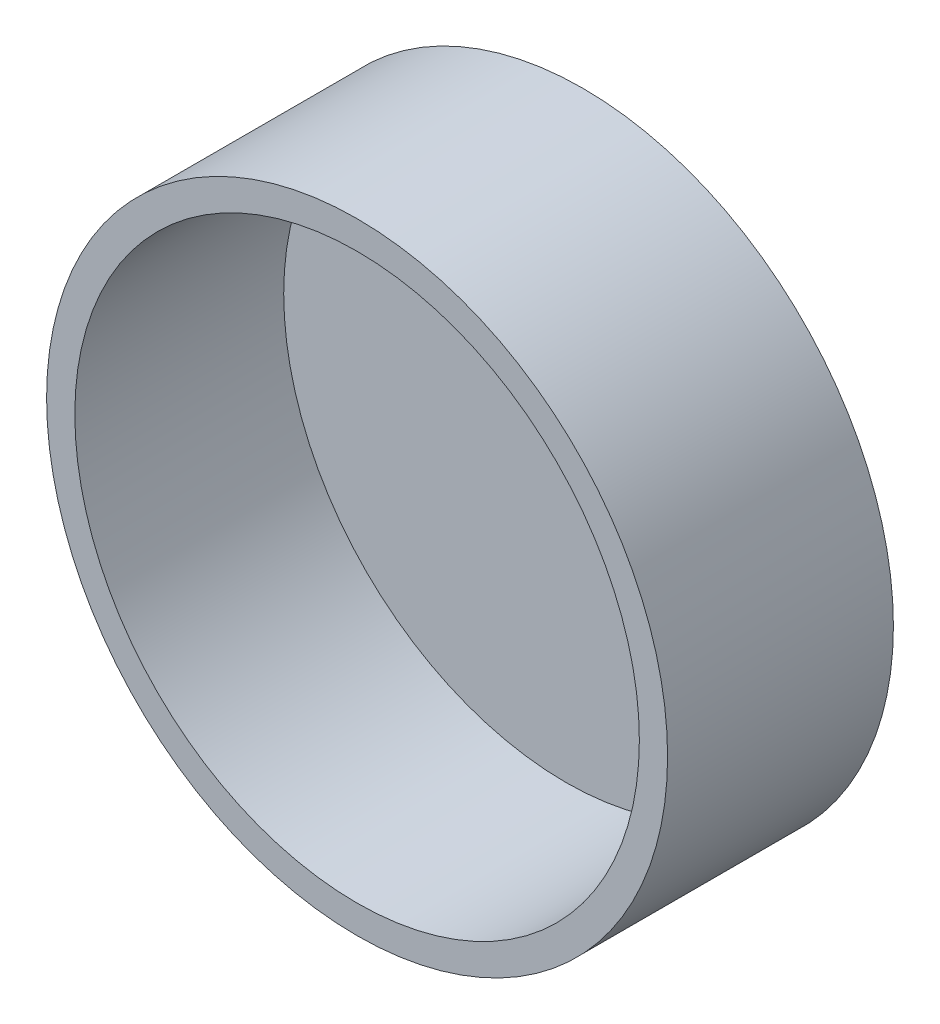
from build123d import *

# Parameters (mm, degrees)
SKETCH1_R           = 100
SKETCH1_R_2         = 14
SKETCH1_R_3         = 2.25
BOSS_EXTRUDE1_DEPTH = 6
SKETCH1_3_R         = 110
SKETCH1_3_R_2       = 100
BOSS_EXTRUDE2_DEPTH = 80
BOSS_EXTRUDE3_START = -5
SKETCH1_10_R        = 17
SKETCH1_10_R_2      = 10.75
SKETCH1_10_R_3      = 10
SKETCH1_10_R_4      = 3
SKETCH1_10_R_5      = 5
SKETCH1_10_R_6      = 2.25
BOSS_EXTRUDE3_DEPTH = 5


with BuildPart() as part:
    # Sketch1 → Boss-Extrude1 (new body)
    with BuildSketch(Plane.XY):
        Circle(SKETCH1_R)
        with Locations((0, 65)):
            Circle(SKETCH1_R_2, mode=Mode.SUBTRACT)
        with Locations((-64.444626073, 54.419906461)):
            Circle(SKETCH1_R_3, mode=Mode.SUBTRACT)
        with BuildLine():
            ThreePointArc((-47.821809018, 65), (-41.121809018, 71.7), (-34.421809018, 65))
            ThreePointArc((-34.421809018, 65), (-41.121809018, 58.3), (-47.821809018, 65))
        make_face(mode=Mode.SUBTRACT)
        with BuildLine():
            ThreePointArc((48.021809018, 65), (41.121809018, 58.1), (34.221809018, 65))
            ThreePointArc((34.221809018, 65), (41.121809018, 71.9), (48.021809018, 65))
        make_face(mode=Mode.SUBTRACT)
    extrude(amount=BOSS_EXTRUDE1_DEPTH)

    # Sketch1<3> → Boss-Extrude2 (add)
    with BuildSketch(Plane.XY):
        Circle(SKETCH1_3_R)
        Circle(SKETCH1_3_R_2, mode=Mode.SUBTRACT)
    extrude(amount=BOSS_EXTRUDE2_DEPTH)

    # Sketch1<10> → Boss-Extrude3 (add)
    # profile 1 of 4: a face of its own
    with BuildSketch(Plane.XY.offset(BOSS_EXTRUDE3_START)):
        with Locations((0, 65)):
            Circle(SKETCH1_10_R)
        with Locations((0, 65)):
            Circle(SKETCH1_10_R_2, mode=Mode.SUBTRACT)
    # profile 2 of 4: a face of its own
    with BuildSketch(Plane.XY.offset(BOSS_EXTRUDE3_START)):
        with Locations((41.121809018, 65)):
            Circle(SKETCH1_10_R_3)
        with BuildLine():
            ThreePointArc((48.021809018, 65), (41.121809018, 58.1), (34.221809018, 65))
            ThreePointArc((34.221809018, 65), (41.121809018, 71.9), (48.021809018, 65))
        make_face(mode=Mode.SUBTRACT)
    # profile 3 of 4: a face of its own
    with BuildSketch(Plane.XY.offset(BOSS_EXTRUDE3_START)):
        with Locations((-41.121809018, 65)):
            Circle(SKETCH1_10_R_3)
        with Locations((-41.121809018, 65)):
            Circle(SKETCH1_10_R_4, mode=Mode.SUBTRACT)
    # profile 4 of 4: a face of its own
    with BuildSketch(Plane.XY.offset(BOSS_EXTRUDE3_START)):
        with Locations((-64.444626073, 54.419906461)):
            Circle(SKETCH1_10_R_5)
        with Locations((-64.444626073, 54.419906461)):
            Circle(SKETCH1_10_R_6, mode=Mode.SUBTRACT)
    extrude(amount=BOSS_EXTRUDE3_DEPTH)


solid = part.part
